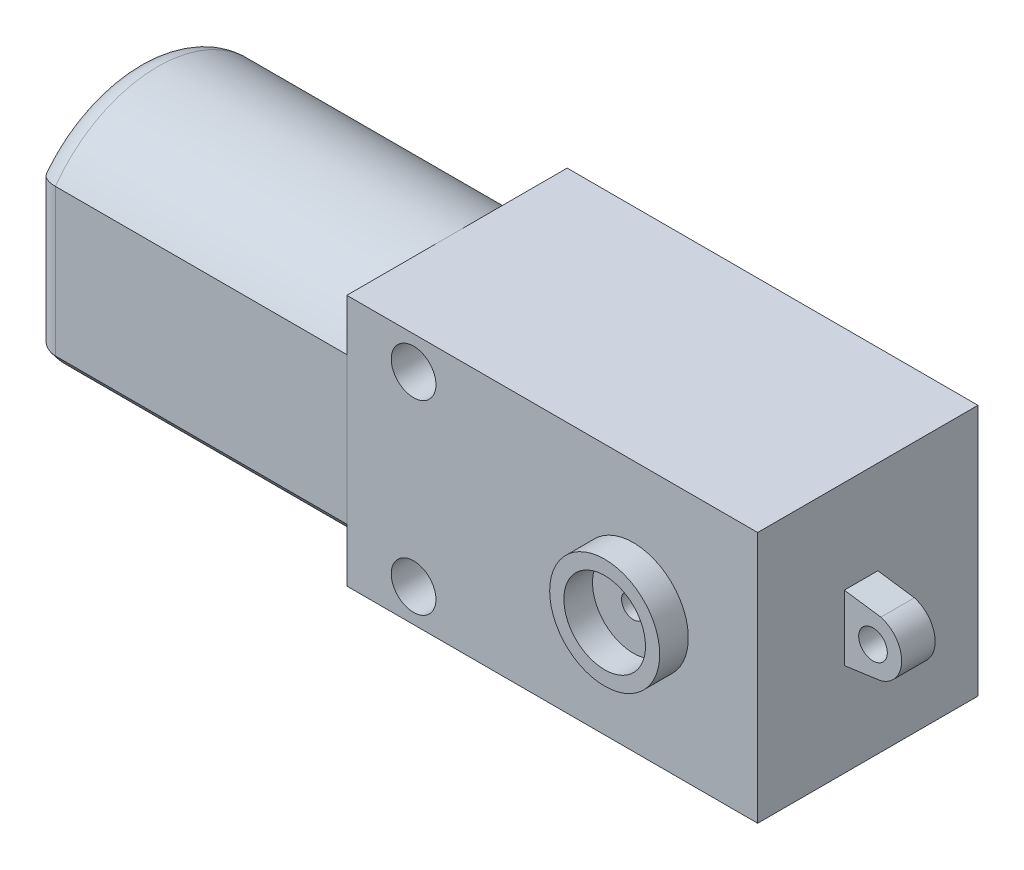
from build123d import *

# Parameters (mm, degrees)
SKETCH1_W           = 18.3388
SKETCH1_H           = 22.3266
BOSS_EXTRUDE1_DEPTH = 36.4236
BOSS_EXTRUDE2_DEPTH = 27.94
SKETCH3_R           = 1.0033
BOSS_EXTRUDE3_DEPTH = 0.9398
SKETCH4_W           = 2.9718
SKETCH4_H           = 5.7912
BOSS_EXTRUDE4_DEPTH = 5.08
SKETCH5_R           = 1.27
CUT_EXTRUDE3_DEPTH  = 2.9718
SKETCH7_R           = 4.8768
SKETCH7_R_2         = 3.6195
BOSS_EXTRUDE5_DEPTH = 2.54
SKETCH9_W           = 36.4236
SKETCH9_H           = 22.3266
BOSS_EXTRUDE6_DEPTH = 1.1938
SKETCH8_R           = 1.0414
SKETCH8_R_2         = 1.9812
CUT_EXTRUDE4_DEPTH  = 19.5326
SKETCH10_R          = 1.8542
BOSS_EXTRUDE7_DEPTH = 1.7526
SKETCH11_W          = 30.653846682
SKETCH11_H          = 27.216421179
CUT_EXTRUDE5_DEPTH  = 0.1
FILLET1_R           = 2


with BuildPart() as part:
    # Sketch1 → Boss-Extrude1 (new body)
    with BuildSketch(Plane(origin=(0, 0, 0), x_dir=(0, 0, -1), z_dir=(1, 0, 0))):
        Rectangle(SKETCH1_W, SKETCH1_H)
    extrude(amount=BOSS_EXTRUDE1_DEPTH)

    # Sketch2 → Boss-Extrude2 (add)
    with BuildSketch(Plane.ZY):
        with BuildLine():
            Line((-9.1694, -6.367210577), (-9.1694, 6.367210577))
            ThreePointArc((-9.1694, 6.367210577), (0, 11.1633), (9.1694, 6.367210577))
            Line((9.1694, 6.367210577), (9.1694, -6.367210577))
            ThreePointArc((9.1694, -6.367210577), (0, -11.1633), (-9.1694, -6.367210577))
        make_face()
    extrude(amount=BOSS_EXTRUDE2_DEPTH)

    # Sketch3 → Boss-Extrude3 (add)
    with BuildSketch(Plane.ZY.offset(27.94)):
        Circle(SKETCH3_R)
    extrude(amount=BOSS_EXTRUDE3_DEPTH)

    # Sketch4 → Boss-Extrude4 (add)
    with BuildSketch(Plane(origin=(36.4236, 0, 0), x_dir=(0, 0, -1), z_dir=(1, 0, 0))):
        Rectangle(SKETCH4_W, SKETCH4_H)
    extrude(amount=BOSS_EXTRUDE4_DEPTH)

    # Sketch5 → Cut-Extrude3 (cut)
    with BuildSketch(Plane.XY.offset(1.4859)):
        with BuildLine():
            Line((36.4236, 2.8956), (39.661128443, 2.442346018))
            ThreePointArc((39.661128443, 2.442346018), (40.991323146, 1.529685864), (41.5036, -2.8e-08))
            Line((41.5036, -2.8e-08), (41.5036, 2.8956))
            Line((41.5036, 2.8956), (36.4236, 2.8956))
        make_face()
        with BuildLine():
            Line((41.5036, -2.8956), (41.5036, -2.8e-08))
            ThreePointArc((41.5036, -2.8e-08), (40.991323129, -1.529685887), (39.661128443, -2.442346018))
            Line((39.661128443, -2.442346018), (36.4236, -2.8956))
            Line((36.4236, -2.8956), (41.5036, -2.8956))
        make_face()
        with Locations((38.9636, 0)):
            Circle(SKETCH5_R)
    extrude(amount=-CUT_EXTRUDE3_DEPTH, mode=Mode.SUBTRACT)

    # Sketch7 → Boss-Extrude5 (add)
    with BuildSketch(Plane.XY.offset(9.1694)):
        with Locations(Location((25.4, 0, 0), (0, 0, 180))):
            Circle(SKETCH7_R)
        with Locations((25.4, 0)):
            Circle(SKETCH7_R_2, mode=Mode.SUBTRACT)
    extrude(amount=BOSS_EXTRUDE5_DEPTH)

    # Sketch9 → Boss-Extrude6 (add)
    with BuildSketch(Plane(origin=(0, 0, -9.1694), x_dir=(-1, 0, 0), z_dir=(0, 0, -1))):
        with Locations((-18.2118, 0)):
            Rectangle(SKETCH9_W, SKETCH9_H)
    extrude(amount=BOSS_EXTRUDE6_DEPTH)

    # Sketch8 → Cut-Extrude4 (cut)
    with BuildSketch(Plane.XY.offset(9.1694)):
        with Locations((25.4, 0)):
            Circle(SKETCH8_R)
        with Locations((5.9182, 8.2423)):
            Circle(SKETCH8_R_2)
        with Locations((5.9182, -8.2423)):
            Circle(SKETCH8_R_2)
    extrude(amount=-CUT_EXTRUDE4_DEPTH, mode=Mode.SUBTRACT)

    # Sketch10 → Boss-Extrude7 (add)
    with BuildSketch(Plane(origin=(0, 0, -10.3632), x_dir=(-1, 0, 0), z_dir=(0, 0, -1))):
        with Locations((-14.5542, 0)):
            Circle(SKETCH10_R)
    extrude(amount=BOSS_EXTRUDE7_DEPTH)

    # Sketch11 → Cut-Extrude5 (cut)
    with BuildSketch(Plane.XY.offset(9.1694)):
        with Locations((-15.326923341, 2.44491059)):
            Rectangle(SKETCH11_W, SKETCH11_H)
    extrude(amount=-CUT_EXTRUDE5_DEPTH, mode=Mode.SUBTRACT)

    # Fillet1
    # the kernel refuses this fillet: 2 mm, written as the material it adds along each edge
    with BuildSketch(Plane(origin=(-27.94, 0, 0), x_dir=(0, 0, 1), z_dir=(0, -1, 0))) as fillet1_piece_1:
        with BuildLine():
            CenterArc((2.699170266, 2), FILLET1_R, 212.012211673, 57.987788327)
            Line((1.0033, 0.9398), (1.0033, 0))
            Line((1.0033, 0), (2.699170266, 0))
        make_face()
    revolve(axis=Axis((-27.94, 0, 0), (-1, 0, 0)))
    # the kernel refuses this fillet: 2 mm, written as the material it takes off along each edge
    with BuildSketch(Plane(origin=(-27.94, -11.367210577, -9.1694), x_dir=(1, 0, 0), z_dir=(0, 1, 0))) as fillet1_2_piece_1:
        with BuildLine():
            CenterArc((FILLET1_R, -FILLET1_R), FILLET1_R, 90, 90)
            Line((0, -FILLET1_R), (0, 0))
            Line((0, 0), (FILLET1_R, 0))
        make_face()
    extrude(amount=22.734421154, mode=Mode.SUBTRACT)
    with BuildSketch(Plane(origin=(-27.94, 0, 0), x_dir=(0, 0.15812676738734943, -0.9874188196685473), z_dir=(0, -0.9874188196685473, -0.15812676738734943))) as fillet1_2_piece_2:
        with BuildLine():
            CenterArc((11.1633 - FILLET1_R, FILLET1_R), FILLET1_R, 270, 90)
            Line((11.1633 - FILLET1_R, 0), (11.1633, 0))
            Line((11.1633, 0), (11.1633, FILLET1_R))
        make_face()
    revolve(axis=Axis((-27.94, 0, 0), (1, 0, 0)), revolution_arc=178.888182092, mode=Mode.SUBTRACT)
    with BuildSketch(Plane(origin=(-27.94, -11.508859388, 9.0694), x_dir=(1, 0, 0), z_dir=(0, 1, 0))) as fillet1_2_piece_3:
        with BuildLine():
            CenterArc((FILLET1_R, FILLET1_R), FILLET1_R, 180, 90)
            Line((0, FILLET1_R), (0, 0))
            Line((0, 0), (FILLET1_R, 0))
        make_face()
    extrude(amount=23.017718776, mode=Mode.SUBTRACT)
    with BuildSketch(Plane(origin=(-27.94, 0, 0), x_dir=(0, 0.1389374526808322, 0.9903011583566695), z_dir=(0, 0.9903011583566695, -0.1389374526808322))) as fillet1_2_piece_4:
        with BuildLine():
            CenterArc((11.1633 - FILLET1_R, FILLET1_R), FILLET1_R, 270, 90)
            Line((11.1633 - FILLET1_R, 0), (11.1633, 0))
            Line((11.1633, 0), (11.1633, FILLET1_R))
        make_face()
    revolve(axis=Axis((-27.94, 0, 0), (1, 0, 0)), revolution_arc=178.888182092, mode=Mode.SUBTRACT)


solid = part.part
